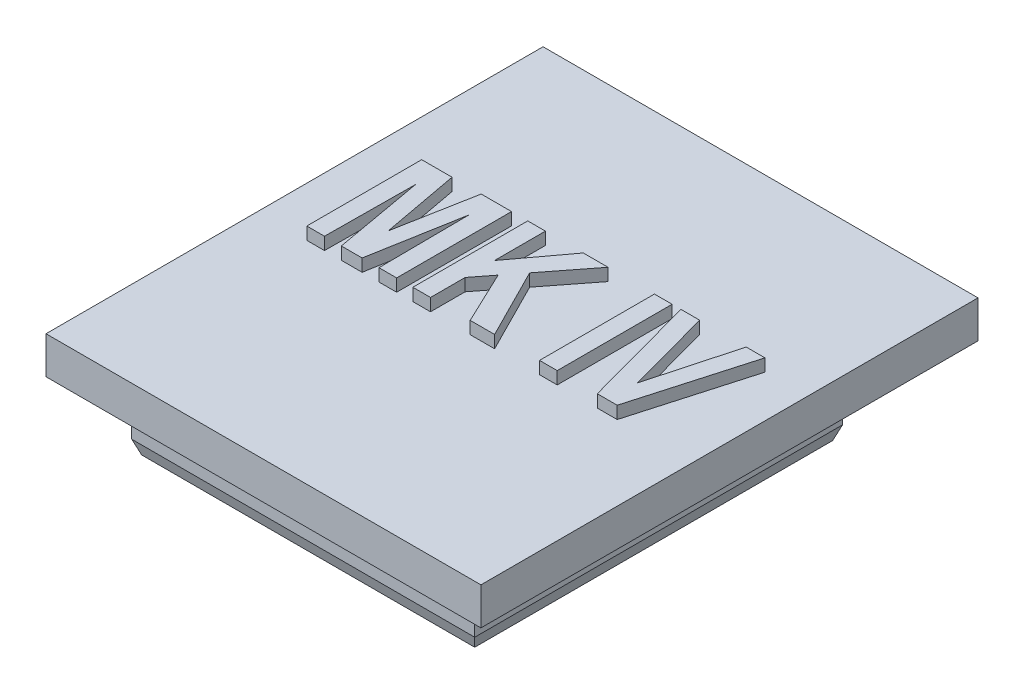
from build123d import *

# Parameters (mm, degrees)
SKETCH1_W           = 27.6
SKETCH1_H           = 29.6
BOSS_EXTRUDE1_DEPTH = 4
SKETCH2_W           = 35
SKETCH2_H           = 40
BOSS_EXTRUDE2_DEPTH = 3
CHAMFER1_SIZE       = 0.4
CHAMFER1_SIZE2      = 1.098990968
SKETCH3_W           = 1.422453426
SKETCH3_H           = 9.245947266
BOSS_EXTRUDE3_DEPTH = 1


with BuildPart() as part:
    # Sketch1 → Boss-Extrude1 (new body)
    with BuildSketch(Plane(origin=(0, 0, 0), x_dir=(1, 0, 0), z_dir=(0, 1, 0))):
        Rectangle(SKETCH1_W, SKETCH1_H)
    extrude(amount=BOSS_EXTRUDE1_DEPTH)

    # Sketch2 → Boss-Extrude2 (add)
    with BuildSketch(Plane(origin=(0, 4, 0), x_dir=(1, 0, 0), z_dir=(0, 1, 0))):
        with Locations((-1.2, 3.2)):
            Rectangle(SKETCH2_W, SKETCH2_H)
    extrude(amount=BOSS_EXTRUDE2_DEPTH)

    # Chamfer1
    chamfer1_edges = [part.edges().sort_by_distance(p)[0] for p in [
        (0, 0, 14.8),
        (13.8, 0, 0),
        (0, 0, -14.8),
        (-13.8, 0, 0),
    ]]
    chamfer1_side = [part.faces().sort_by_distance(p)[0] for p in [
        (0, 0, 0),
    ]]
    chamfer(chamfer1_edges, length=CHAMFER1_SIZE, length2=CHAMFER1_SIZE2, reference=chamfer1_side[0])

    # Sketch3 → Boss-Extrude3 (add)
    with BuildSketch(Plane(origin=(0, 7, 0), x_dir=(1, 0, 0), z_dir=(0, 1, 0))):
        Polygon((-14.713307542, 0.2), (-14.713307542, 9.445947266), (-12.27031787, 9.445947266), (-11.097905086, 3.139366649), (-9.925492301, 9.445947266), (-7.482502629, 9.445947266), (-7.482502629, 0.2), (-8.904956055, 0.2), (-8.964224947, 7.478960888), (-10.260731976, 0.2), (-11.935078195, 0.2), (-13.231585224, 7.478960888), (-13.290854117, 0.2), align=None)
        Polygon((-6.178586989, 0.2), (-6.178586989, 9.445947266), (-4.756133564, 9.445947266), (-4.756133564, 5.347132903), (-1.709342047, 9.445947266), (0.281722318, 9.445947266), (-2.481689805, 5.902778772), (0.400260104, 0.2), (-1.564874121, 0.2), (-3.594833697, 4.476621041), (-4.756133564, 2.987490111), (-4.756133564, 0.2), align=None)
        with Locations((4.726889273, 4.822973633)):
            Rectangle(SKETCH3_W, SKETCH3_H)
        Polygon((8.664566333, 0.2), (6.149342698, 9.445947266), (7.656995157, 9.445947266), (9.527669584, 2.570755709), (11.400196163, 9.445947266), (12.905996469, 9.445947266), (10.264826437, 0.2), align=None)
    extrude(amount=BOSS_EXTRUDE3_DEPTH)


solid = part.part
